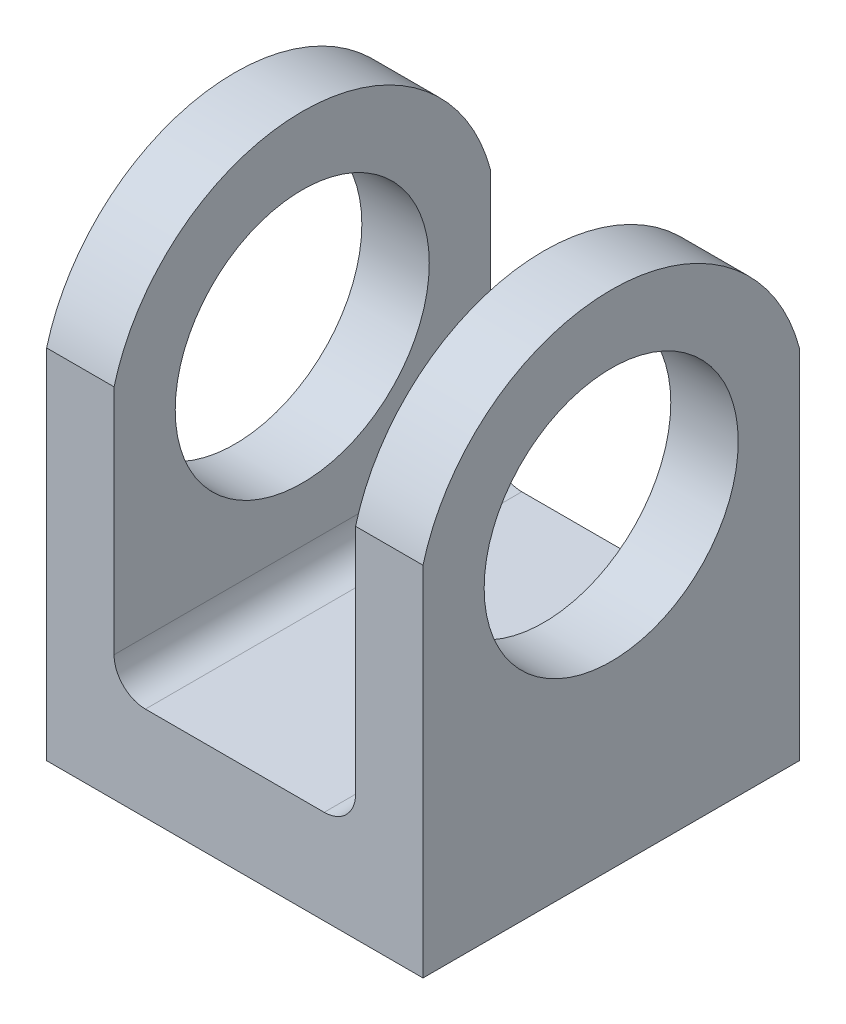
from build123d import *

# Parameters (mm, degrees)
SKETCH1_W             = 120
SKETCH1_H             = 160
BOSS_EXTRUDE1_DEPTH   = 120
SKETCH2_W             = 77
SKETCH2_H             = 260
CUT_EXTRUDE1_DEPTH    = 157.204993518
HINGE_HOLE_DEPTH      = 175.648933578
HINGE_HOLE_DEPTH_BACK = 175.648933578
SKETCH3_R             = 40.5
FILLET1_R             = 10
CUT_EXTRUDE2_DEPTH    = 188.616630393


with BuildPart() as part:
    # Sketch1 → Boss-Extrude1 (new body)
    with BuildSketch(Plane.XY):
        Rectangle(SKETCH1_W, SKETCH1_H)
    extrude(amount=BOSS_EXTRUDE1_DEPTH)

    # Sketch2 → Cut-Extrude1 (cut, through all)
    with BuildSketch(Plane.XY.offset(120)):
        with Locations((0, 80)):
            Rectangle(SKETCH2_W, SKETCH2_H)
    extrude(amount=-CUT_EXTRUDE1_DEPTH, mode=Mode.SUBTRACT)

    # Sketch3 → Hinge Hole (cut, two sides: drawn at the far end of the back side and taken through both)
    with BuildSketch(Plane(origin=(-38.5, 0, 0), x_dir=(0, 0, -1), z_dir=(1, 0, 0)).offset(-HINGE_HOLE_DEPTH_BACK)):
        with Locations((-60, 17.878893252)):
            Circle(SKETCH3_R)
    extrude(amount=HINGE_HOLE_DEPTH + HINGE_HOLE_DEPTH_BACK, mode=Mode.SUBTRACT)

    # Fillet1
    fillet1_edges = [part.edges().sort_by_distance(p)[0] for p in [
        (38.5, -50, 60),
        (-38.5, -50, 60),
    ]]
    fillet(fillet1_edges, radius=FILLET1_R)

    # Sketch4 → Cut-Extrude2 (cut, through all)
    with BuildSketch(Plane(origin=(60, 0, 0), x_dir=(0, 0, -1), z_dir=(1, 0, 0))):
        with BuildLine():
            ThreePointArc((-120, 33.973361358), (-97.810221715, 67.168030366), (-60, 80))
            Line((-60, 80), (-120, 80))
            Line((-120, 80), (-120, 33.973361358))
        make_face()
        with BuildLine():
            ThreePointArc((-60, 80), (-22.189778285, 67.168030366), (0, 33.973361358))
            Line((0, 33.973361358), (0, 80))
            Line((0, 80), (-60, 80))
        make_face()
    extrude(amount=-CUT_EXTRUDE2_DEPTH, mode=Mode.SUBTRACT)


solid = part.part
